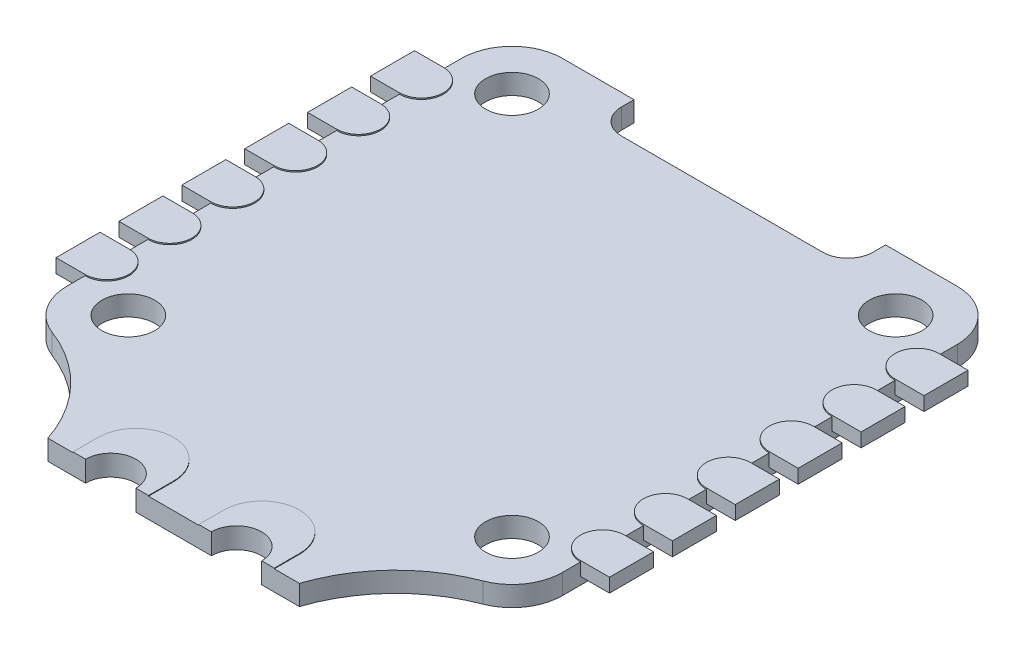
from build123d import *

# Parameters (mm, degrees)
SKETCH1_R                = 2.1
BOSS_EXTRUDE1_DEPTH      = 0.8
FILLET1_R                = 12
BOSS_EXTRUDE3_DEPTH      = 0.05
BOSS_EXTRUDE4_DEPTH      = 0.1
BOSS_EXTRUDE4_DEPTH_BACK = 1


with BuildPart() as part:
    # Sketch1 → Boss-Extrude1 (new, symmetric)
    with BuildSketch(Plane(origin=(0, 0, 0), x_dir=(1, 0, 0), z_dir=(0, 1, 0))):
        with BuildLine():
            Line((-10, 18.7), (-10, 19.7))
            Line((-10, 19.7), (-15.7, 19.7))
            ThreePointArc((-15.7, 19.7), (-18.528427125, 18.528427125), (-19.7, 15.7))
            Line((-19.7, 15.7), (-19.7, -15.7))
            ThreePointArc((-19.7, -15.7), (-18.528427125, -18.528427125), (-15.7, -19.7))
            Line((-15.7, -19.7), (-10, -19.7))
            Line((-10, -19.7), (-10, -26.9))
            Line((-10, -26.9), (-7, -26.9))
            ThreePointArc((-7, -26.9), (-5, -24.9), (-3, -26.9))
            Line((-3, -26.9), (3, -26.9))
            ThreePointArc((3, -26.9), (5, -24.9), (7, -26.9))
            Line((7, -26.9), (10, -26.9))
            Line((10, -26.9), (10, -19.7))
            Line((10, -19.7), (15.7, -19.7))
            ThreePointArc((15.7, -19.7), (18.528427125, -18.528427125), (19.7, -15.7))
            Line((19.7, -15.7), (19.7, 15.7))
            ThreePointArc((19.7, 15.7), (18.528427125, 18.528427125), (15.7, 19.7))
            Line((15.7, 19.7), (10, 19.7))
            Line((10, 19.7), (10, 18.7))
            ThreePointArc((10, 18.7), (9.414213562, 17.285786438), (8, 16.7))
            Line((8, 16.7), (-8, 16.7))
            ThreePointArc((-8, 16.7), (-9.414213562, 17.285786438), (-10, 18.7))
        make_face()
        with Locations(Location((-15.25, -15.25, 0), (0, 0, 270))):
            Circle(SKETCH1_R, mode=Mode.SUBTRACT)
        with Locations(Location((15.25, -15.25, 0), (0, 0, 270))):
            Circle(SKETCH1_R, mode=Mode.SUBTRACT)
        with Locations(Location((-15.25, 15.25, 0), (0, 0, 270))):
            Circle(SKETCH1_R, mode=Mode.SUBTRACT)
        with Locations(Location((15.25, 15.25, 0), (0, 0, 270))):
            Circle(SKETCH1_R, mode=Mode.SUBTRACT)
    extrude(amount=BOSS_EXTRUDE1_DEPTH, both=True)

    # Fillet1
    # the kernel refuses this fillet: 12 mm, written as the material it adds along each edge
    with BuildSketch(Plane(origin=(-10, -0.8, 19.7), x_dir=(0, 0, 1), z_dir=(0, 1, 0))) as fillet1_piece_1:
        with BuildLine():
            CenterArc((10.950716979, -11.398777221), FILLET1_R, 108.21356071, 50.921051977)
            Line((-0.262320755, -7.124694305), (-1.383624529, -6.697286014))
            ThreePointArc((-1.383624529, -6.697286014), (-1.2, -5.7), (-1.2, 0))
            Line((-1.2, 0), (0, 1.2))
            ThreePointArc((0, 1.2), (3.6, 1.2), (6.824928302, 1.139877722))
            Line((6.824928302, 1.139877722), (7.2, 0))
        make_face()
    extrude(amount=1.6)
    with BuildSketch(Plane(origin=(10, -0.8, 19.7), x_dir=(0.9993228863513164, 0, -0.03679359746578182), z_dir=(0, 1, 0))) as fillet1_piece_2:
        with BuildLine():
            CenterArc((10.988142681, -11.36270412), FILLET1_R, 108.756793525, 50.921051977)
            Line((-0.264913902, -7.195124782), (-1.39021956, -6.778366848))
            ThreePointArc((-1.39021956, -6.778366848), (-1.331644414, -3.553410074), (-1.199187464, 0.044152317))
            Line((-1.199187464, 0.044152317), (0.044152317, 1.199187464))
            ThreePointArc((0.044152317, 1.199187464), (5.740292769, 0.989463958), (6.743659714, 1.136270412))
            Line((6.743659714, 1.136270412), (7.129521802, 0))
        make_face()
    extrude(amount=1.6)

    # Sketch4 → Boss-Extrude3 (add, symmetric)
    with BuildSketch(Plane(origin=(0, 0.8, 0), x_dir=(1, 0, 0), z_dir=(0, 1, 0))):
        with BuildLine():
            Line((-8, -24.9), (-8, -26.9))
            Line((-8, -26.9), (-7, -26.9))
            ThreePointArc((-7, -26.9), (-5, -24.9), (-3, -26.9))
            Line((-3, -26.9), (-2, -26.9))
            Line((-2, -26.9), (-2, -24.9))
            ThreePointArc((-2, -24.9), (-5, -21.9), (-8, -24.9))
        make_face()
        with BuildLine():
            Line((2, -24.9), (2, -26.9))
            Line((2, -26.9), (3, -26.9))
            ThreePointArc((3, -26.9), (5, -24.9), (7, -26.9))
            Line((7, -26.9), (8, -26.9))
            Line((8, -26.9), (8, -24.9))
            ThreePointArc((8, -24.9), (5, -21.9), (2, -24.9))
        make_face()
    extrude(amount=BOSS_EXTRUDE3_DEPTH, both=True)

    # Sketch5 → Boss-Extrude4 (add, two sides: drawn at the far end of the back side and taken through both)
    with BuildSketch(Plane(origin=(0, 0.8, 0), x_dir=(1, 0, 0), z_dir=(0, 1, 0)).offset(-BOSS_EXTRUDE4_DEPTH_BACK)):
        with BuildLine():
            ThreePointArc((-17.95, -12.5), (-18.462563133, -11.262563133), (-19.7, -10.75))
            Line((-19.7, -10.75), (-19.7, -14.25))
            ThreePointArc((-19.7, -14.25), (-18.462563133, -13.737436867), (-17.95, -12.5))
        make_face()
        with BuildLine():
            Line((-19.7, -14.25), (-19.7, -10.75))
            ThreePointArc((-19.7, -10.75), (-21.45, -12.5), (-19.7, -14.25))
        make_face()
        with BuildLine():
            ThreePointArc((-19.7, -14.25), (-21.45, -12.5), (-19.7, -10.75))
            Line((-19.7, -10.75), (-22, -10.75))
            Line((-22, -10.75), (-22, -14.25))
            Line((-22, -14.25), (-19.7, -14.25))
        make_face()
        with BuildLine():
            ThreePointArc((-17.95, -7.5), (-18.462563133, -6.262563133), (-19.7, -5.75))
            Line((-19.7, -5.75), (-19.7, -9.25))
            ThreePointArc((-19.7, -9.25), (-18.462563133, -8.737436867), (-17.95, -7.5))
        make_face()
        with BuildLine():
            Line((-19.7, -9.25), (-19.7, -5.75))
            ThreePointArc((-19.7, -5.75), (-21.45, -7.5), (-19.7, -9.25))
        make_face()
        with BuildLine():
            ThreePointArc((-19.7, -9.25), (-21.45, -7.5), (-19.7, -5.75))
            Line((-19.7, -5.75), (-22, -5.75))
            Line((-22, -5.75), (-22, -9.25))
            Line((-22, -9.25), (-19.7, -9.25))
        make_face()
        with BuildLine():
            ThreePointArc((-17.95, -2.5), (-18.462563133, -1.262563133), (-19.7, -0.75))
            Line((-19.7, -0.75), (-19.7, -4.25))
            ThreePointArc((-19.7, -4.25), (-18.462563133, -3.737436867), (-17.95, -2.5))
        make_face()
        with BuildLine():
            Line((-19.7, -4.25), (-19.7, -0.75))
            ThreePointArc((-19.7, -0.75), (-21.45, -2.5), (-19.7, -4.25))
        make_face()
        with BuildLine():
            ThreePointArc((-19.7, -4.25), (-21.45, -2.5), (-19.7, -0.75))
            Line((-19.7, -0.75), (-22, -0.75))
            Line((-22, -0.75), (-22, -4.25))
            Line((-22, -4.25), (-19.7, -4.25))
        make_face()
        with BuildLine():
            Line((-19.7, 0.75), (-19.7, 4.25))
            ThreePointArc((-19.7, 4.25), (-21.45, 2.5), (-19.7, 0.75))
        make_face()
        with BuildLine():
            ThreePointArc((-17.95, 2.5), (-18.462563133, 3.737436867), (-19.7, 4.25))
            Line((-19.7, 4.25), (-19.7, 0.75))
            ThreePointArc((-19.7, 0.75), (-18.462563133, 1.262563133), (-17.95, 2.5))
        make_face()
        with BuildLine():
            ThreePointArc((-19.7, 0.75), (-21.45, 2.5), (-19.7, 4.25))
            Line((-19.7, 4.25), (-22, 4.25))
            Line((-22, 4.25), (-22, 0.75))
            Line((-22, 0.75), (-19.7, 0.75))
        make_face()
        with BuildLine():
            ThreePointArc((-19.7, 9.25), (-21.45, 7.5), (-19.7, 5.75))
            Line((-19.7, 5.75), (-19.7, 9.25))
        make_face()
        with BuildLine():
            Line((-19.7, 9.25), (-19.7, 5.75))
            ThreePointArc((-19.7, 5.75), (-18.462563133, 6.262563133), (-17.95, 7.5))
            ThreePointArc((-17.95, 7.5), (-18.462563133, 8.737436867), (-19.7, 9.25))
        make_face()
        with BuildLine():
            Line((-22, 5.75), (-19.7, 5.75))
            ThreePointArc((-19.7, 5.75), (-21.45, 7.5), (-19.7, 9.25))
            Line((-19.7, 9.25), (-22, 9.25))
            Line((-22, 9.25), (-22, 5.75))
        make_face()
        with BuildLine():
            ThreePointArc((-19.7, 14.25), (-21.45, 12.5), (-19.7, 10.75))
            Line((-19.7, 10.75), (-19.7, 14.25))
        make_face()
        with BuildLine():
            Line((-19.7, 14.25), (-19.7, 10.75))
            ThreePointArc((-19.7, 10.75), (-18.462563133, 11.262563133), (-17.95, 12.5))
            ThreePointArc((-17.95, 12.5), (-18.462563133, 13.737436867), (-19.7, 14.25))
        make_face()
        with BuildLine():
            Line((-22, 10.75), (-19.7, 10.75))
            ThreePointArc((-19.7, 10.75), (-21.45, 12.5), (-19.7, 14.25))
            Line((-19.7, 14.25), (-22, 14.25))
            Line((-22, 14.25), (-22, 10.75))
        make_face()
        with BuildLine():
            ThreePointArc((21.45, -12.5), (20.937436867, -11.262563133), (19.7, -10.75))
            Line((19.7, -10.75), (19.7, -14.25))
            ThreePointArc((19.7, -14.25), (20.937436867, -13.737436867), (21.45, -12.5))
        make_face()
        with BuildLine():
            Line((19.7, -14.25), (19.7, -10.75))
            ThreePointArc((19.7, -10.75), (17.95, -12.5), (19.7, -14.25))
        make_face()
        with BuildLine():
            Line((22, -10.75), (19.7, -10.75))
            ThreePointArc((19.7, -10.75), (20.937436867, -11.262563133), (21.45, -12.5))
            ThreePointArc((21.45, -12.5), (20.937436867, -13.737436867), (19.7, -14.25))
            Line((19.7, -14.25), (22, -14.25))
            Line((22, -14.25), (22, -10.75))
        make_face()
        with BuildLine():
            Line((22, -5.75), (19.7, -5.75))
            ThreePointArc((19.7, -5.75), (20.937436867, -6.262563133), (21.45, -7.5))
            ThreePointArc((21.45, -7.5), (20.937436867, -8.737436867), (19.7, -9.25))
            Line((19.7, -9.25), (22, -9.25))
            Line((22, -9.25), (22, -5.75))
        make_face()
        with BuildLine():
            ThreePointArc((21.45, -7.5), (20.937436867, -6.262563133), (19.7, -5.75))
            Line((19.7, -5.75), (19.7, -9.25))
            ThreePointArc((19.7, -9.25), (20.937436867, -8.737436867), (21.45, -7.5))
        make_face()
        with BuildLine():
            Line((19.7, -9.25), (19.7, -5.75))
            ThreePointArc((19.7, -5.75), (17.95, -7.5), (19.7, -9.25))
        make_face()
        with BuildLine():
            Line((19.7, -0.75), (19.7, -4.25))
            ThreePointArc((19.7, -4.25), (20.937436867, -3.737436867), (21.45, -2.5))
            ThreePointArc((21.45, -2.5), (20.937436867, -1.262563133), (19.7, -0.75))
        make_face()
        with BuildLine():
            ThreePointArc((19.7, -0.75), (17.95, -2.5), (19.7, -4.25))
            Line((19.7, -4.25), (19.7, -0.75))
        make_face()
        with BuildLine():
            ThreePointArc((21.45, -2.5), (20.937436867, -3.737436867), (19.7, -4.25))
            Line((19.7, -4.25), (22, -4.25))
            Line((22, -4.25), (22, -0.75))
            Line((22, -0.75), (19.7, -0.75))
            ThreePointArc((19.7, -0.75), (20.937436867, -1.262563133), (21.45, -2.5))
        make_face()
        with BuildLine():
            ThreePointArc((19.7, 4.25), (17.95, 2.5), (19.7, 0.75))
            Line((19.7, 0.75), (19.7, 4.25))
        make_face()
        with BuildLine():
            Line((19.7, 4.25), (19.7, 0.75))
            ThreePointArc((19.7, 0.75), (20.937436867, 1.262563133), (21.45, 2.5))
            ThreePointArc((21.45, 2.5), (20.937436867, 3.737436867), (19.7, 4.25))
        make_face()
        with BuildLine():
            ThreePointArc((21.45, 2.5), (20.937436867, 1.262563133), (19.7, 0.75))
            Line((19.7, 0.75), (22, 0.75))
            Line((22, 0.75), (22, 4.25))
            Line((22, 4.25), (19.7, 4.25))
            ThreePointArc((19.7, 4.25), (20.937436867, 3.737436867), (21.45, 2.5))
        make_face()
        with BuildLine():
            ThreePointArc((19.7, 9.25), (17.95, 7.5), (19.7, 5.75))
            Line((19.7, 5.75), (19.7, 9.25))
        make_face()
        with BuildLine():
            Line((19.7, 9.25), (19.7, 5.75))
            ThreePointArc((19.7, 5.75), (20.937436867, 6.262563133), (21.45, 7.5))
            ThreePointArc((21.45, 7.5), (20.937436867, 8.737436867), (19.7, 9.25))
        make_face()
        with BuildLine():
            ThreePointArc((21.45, 7.5), (20.937436867, 6.262563133), (19.7, 5.75))
            Line((19.7, 5.75), (22, 5.75))
            Line((22, 5.75), (22, 9.25))
            Line((22, 9.25), (19.7, 9.25))
            ThreePointArc((19.7, 9.25), (20.937436867, 8.737436867), (21.45, 7.5))
        make_face()
        with BuildLine():
            ThreePointArc((19.7, 14.25), (17.95, 12.5), (19.7, 10.75))
            Line((19.7, 10.75), (19.7, 14.25))
        make_face()
        with BuildLine():
            Line((19.7, 14.25), (19.7, 10.75))
            ThreePointArc((19.7, 10.75), (20.937436867, 11.262563133), (21.45, 12.5))
            ThreePointArc((21.45, 12.5), (20.937436867, 13.737436867), (19.7, 14.25))
        make_face()
        with BuildLine():
            ThreePointArc((21.45, 12.5), (20.937436867, 11.262563133), (19.7, 10.75))
            Line((19.7, 10.75), (22, 10.75))
            Line((22, 10.75), (22, 14.25))
            Line((22, 14.25), (19.7, 14.25))
            ThreePointArc((19.7, 14.25), (20.937436867, 13.737436867), (21.45, 12.5))
        make_face()
    extrude(amount=BOSS_EXTRUDE4_DEPTH + BOSS_EXTRUDE4_DEPTH_BACK)


solid = part.part
